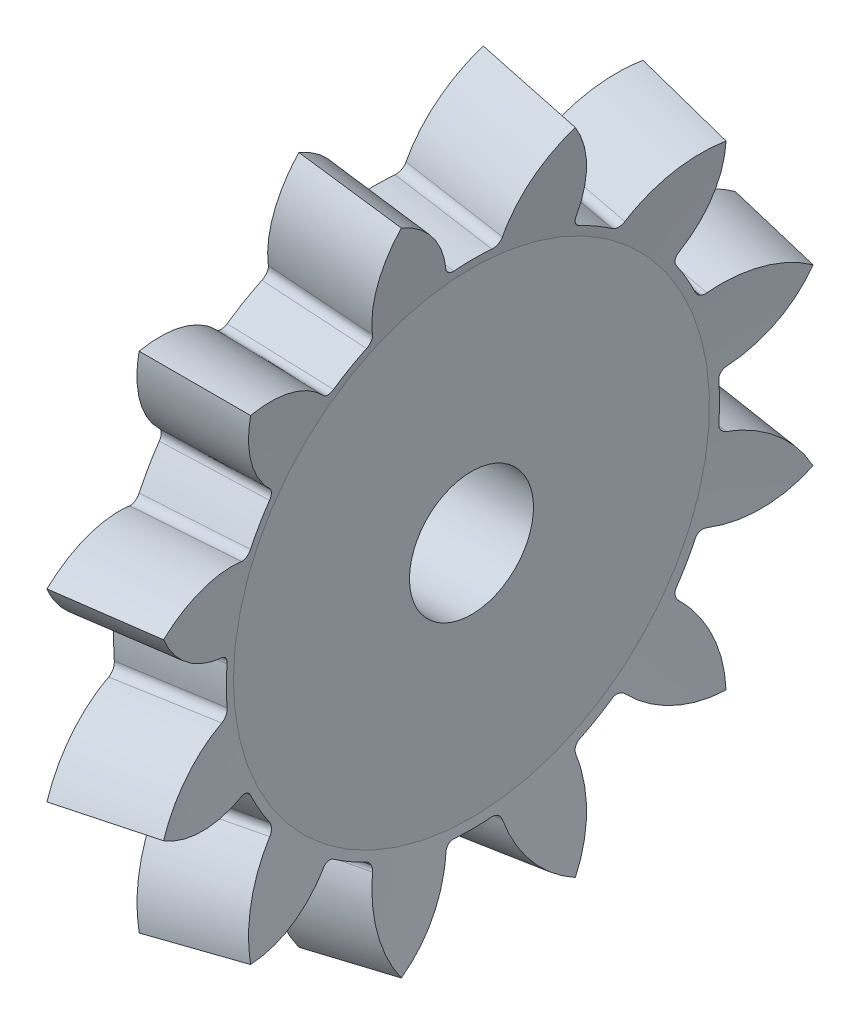
from build123d import *

# Parameters (mm, degrees)
TOOCUTSKE2_R    = 0.0127
TEETHCUTS_COUNT = 12
TEETHCUTS_ANGLE = 330
HUBSKE_R        = 2.5
HUB_DEPTH       = 0.0001016
BORSKE_R        = 2.5
BORE_DEPTH      = 70.313486436


with BuildPart() as part:
    # BasProSke → Base-Revolve (revolve)
    with BuildSketch(Plane(origin=(0, 0, 0), x_dir=(1, 0, 0), z_dir=(0, 1, 0))):
        Polygon((0, 0), (0, 10.171625459), (0.802241747, 14.851368977), (4.717200584, 14.014920988), (3.960142113, 9.598746577), (3.960142113, 0), align=None)
    revolve(axis=Axis((-10, 0, 0), (1, 0, 0)))

    # TooCutSke2 → ToothCut section 0
    with BuildSketch(Plane(origin=(68.306073472, -11.709612609, 0), x_dir=(0, 0, 1), z_dir=(-0.9856222547804889, 0.168963815302049, 0))):
        with Locations((0, 11.880426338)):
            Circle(TOOCUTSKE2_R)
    # TooCutSke → ToothCut section 1
    with BuildSketch(Plane(origin=(0.401120873, 12.511497218, 0), x_dir=(0, 0, -1), z_dir=(-0.9856222547804889, 0.16896381530204896, 0))):
        with BuildLine():
            ThreePointArc((-4.991668997, -1.828317367), (0, -2.671863857), (4.991668997, -1.828317367))
            ThreePointArc((4.991668997, -1.828317367), (2.572494875, -0.597718455), (1.20752957, 1.748266803))
            ThreePointArc((1.20752957, 1.748266803), (1.062428565, 1.963920887), (0.812244338, 2.034410875))
            ThreePointArc((0.812244338, 2.034410875), (0, 2.002995408), (-0.812244338, 2.034410875))
            ThreePointArc((-0.812244338, 2.034410875), (-1.062428565, 1.963920887), (-1.20752957, 1.748266803))
            ThreePointArc((-1.20752957, 1.748266803), (-2.572494875, -0.597718455), (-4.991668997, -1.828317367))
        make_face()
    toothcut = loft(mode=Mode.SUBTRACT)

    # TeethCuts: ToothCut ×12 about axis
    teethcuts_axis = Axis((-10, 0, 0), (1, 0, 0))
    for i in range(1, TEETHCUTS_COUNT):
        add(toothcut.rotate(teethcuts_axis, i * TEETHCUTS_ANGLE / (TEETHCUTS_COUNT - 1)), mode=Mode.SUBTRACT)

    # HubSke → Hub (add)
    with BuildSketch(Plane.ZY):
        Circle(HUBSKE_R)
    extrude(amount=HUB_DEPTH)

    # BorSke → Bore (cut, symmetric)
    with BuildSketch(Plane(origin=(0, 0, 0), x_dir=(0, 0, -1), z_dir=(1, 0, 0))):
        Circle(BORSKE_R)
    extrude(amount=BORE_DEPTH, both=True, mode=Mode.SUBTRACT)


solid = part.part
